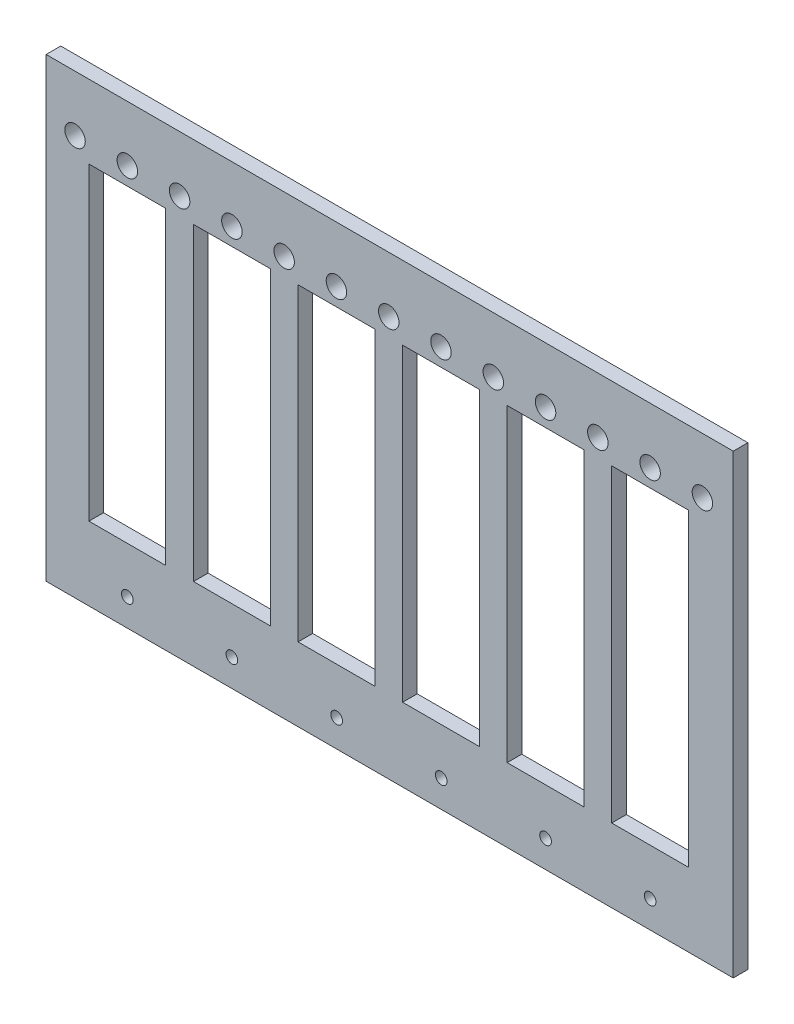
from build123d import *

# Parameters (mm, degrees)
SKETCH1_W           = 469.86
SKETCH1_H           = 312
SKETCH1_R           = 7
SKETCH1_R_2         = 4
SKETCH1_W_2         = 52.5
SKETCH1_H_2         = 211.5
BOSS_EXTRUDE1_DEPTH = 10


with BuildPart() as part:
    # Sketch1 → Boss-Extrude1 (new body)
    with BuildSketch(Plane.XY):
        with Locations((213.66, 105.75)):
            Rectangle(SKETCH1_W, SKETCH1_H)
        with Locations((391.75, 223.576371014)):
            Circle(SKETCH1_R, mode=Mode.SUBTRACT)
        with Locations((320.25, 223.576371014)):
            Circle(SKETCH1_R, mode=Mode.SUBTRACT)
        with Locations((248.75, 223.576371014)):
            Circle(SKETCH1_R, mode=Mode.SUBTRACT)
        with Locations((177.25, 223.576371014)):
            Circle(SKETCH1_R, mode=Mode.SUBTRACT)
        with Locations((105.75, 223.576371014)):
            Circle(SKETCH1_R, mode=Mode.SUBTRACT)
        with Locations((34.25, 223.576371014)):
            Circle(SKETCH1_R, mode=Mode.SUBTRACT)
        with Locations((34.25, -31.693386741)):
            Circle(SKETCH1_R_2, mode=Mode.SUBTRACT)
        with Locations((105.75, -31.693386741)):
            Circle(SKETCH1_R_2, mode=Mode.SUBTRACT)
        with Locations((177.416390645, -31.693386741)):
            Circle(SKETCH1_R_2, mode=Mode.SUBTRACT)
        with Locations((248.916390645, -31.693386741)):
            Circle(SKETCH1_R_2, mode=Mode.SUBTRACT)
        with Locations((320.25, -31.693386741)):
            Circle(SKETCH1_R_2, mode=Mode.SUBTRACT)
        with Locations((391.75, -31.693386741)):
            Circle(SKETCH1_R_2, mode=Mode.SUBTRACT)
        with Locations((70, 223.576371014)):
            Circle(SKETCH1_R, mode=Mode.SUBTRACT)
        with Locations((141.5, 223.576371014)):
            Circle(SKETCH1_R, mode=Mode.SUBTRACT)
        with Locations((213, 223.576371014)):
            Circle(SKETCH1_R, mode=Mode.SUBTRACT)
        with Locations((284.5, 223.576371014)):
            Circle(SKETCH1_R, mode=Mode.SUBTRACT)
        with Locations((356, 223.576371014)):
            Circle(SKETCH1_R, mode=Mode.SUBTRACT)
        with Locations((427.5, 223.576371014)):
            Circle(SKETCH1_R, mode=Mode.SUBTRACT)
        with Locations((-1.5, 223.576371014)):
            Circle(SKETCH1_R, mode=Mode.SUBTRACT)
        with Locations((34.25, 105.75)):
            Rectangle(SKETCH1_W_2, SKETCH1_H_2, mode=Mode.SUBTRACT)
        with Locations((105.75, 105.75)):
            Rectangle(SKETCH1_W_2, SKETCH1_H_2, mode=Mode.SUBTRACT)
        with Locations((177.25, 105.75)):
            Rectangle(SKETCH1_W_2, SKETCH1_H_2, mode=Mode.SUBTRACT)
        with Locations((248.75, 105.75)):
            Rectangle(SKETCH1_W_2, SKETCH1_H_2, mode=Mode.SUBTRACT)
        with Locations((320.25, 105.75)):
            Rectangle(SKETCH1_W_2, SKETCH1_H_2, mode=Mode.SUBTRACT)
        with Locations((391.75, 105.75)):
            Rectangle(SKETCH1_W_2, SKETCH1_H_2, mode=Mode.SUBTRACT)
    extrude(amount=BOSS_EXTRUDE1_DEPTH)


solid = part.part
